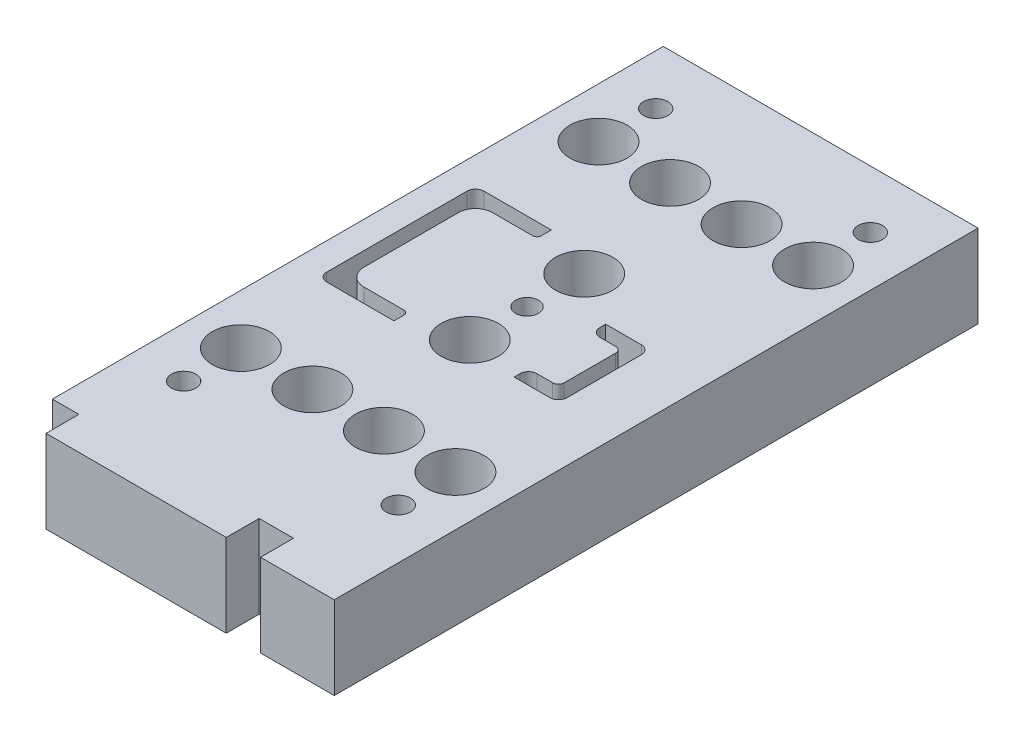
from build123d import *

# Parameters (mm, degrees)
SKETCH1_W           = 110
SKETCH1_H           = 225
BOSS_EXTRUDE1_DEPTH = 29
CUT_EXTRUDE1_REACH  = 130.539
CUT_EXTRUDE2_REACH  = 130.539
SKETCH4_R           = 8.5
CUT_EXTRUDE3_DEPTH  = 5
SKETCH5_R           = 10
CUT_EXTRUDE4_DEPTH  = 20
CUT_EXTRUDE5_REACH  = 130.539
SKETCH6_W           = 12
SKETCH6_H           = 11.5
M10_TAPPED_HOLE1_D  = 8.5
CUT_EXTRUDE6_REACH  = 130.539
SKETCH10_R          = 4


with BuildPart() as part:
    # Sketch1 → Boss-Extrude1 (new body)
    with BuildSketch(Plane(origin=(0, 0, 0), x_dir=(1, 0, 0), z_dir=(0, 1, 0))):
        Rectangle(SKETCH1_W, SKETCH1_H)
    extrude(amount=-BOSS_EXTRUDE1_DEPTH)

    # Sketch2 → Cut-Extrude1 (cut, up to next)
    with BuildSketch(Plane(origin=(0, 0, 0), x_dir=(1, 0, 0), z_dir=(0, 1, 0)), mode=Mode.PRIVATE) as cut_extrude1_sk1:
        with BuildLine():
            Line((-19, 37.36), (-19, 33.86))
            ThreePointArc((-19, 33.86), (-19.439339828, 32.799339828), (-20.5, 32.36))
            Line((-20.5, 32.36), (-34.5, 32.36))
            ThreePointArc((-34.5, 32.36), (-38.742640687, 30.602640687), (-40.5, 26.36))
            Line((-40.5, 26.36), (-40.5, -6.64))
            ThreePointArc((-40.5, -6.64), (-38.742640687, -10.882640687), (-34.5, -12.64))
            Line((-34.5, -12.64), (-20.5, -12.64))
            ThreePointArc((-20.5, -12.64), (-19.439339828, -13.079339828), (-19, -14.14))
            Line((-19, -14.14), (-19, -17.64))
            Line((-19, -17.64), (-42.5, -17.64))
            ThreePointArc((-42.5, -17.64), (-44.621320344, -16.761320344), (-45.5, -14.64))
            Line((-45.5, -14.64), (-45.5, 34.36))
            ThreePointArc((-45.5, 34.36), (-44.621320344, 36.481320344), (-42.5, 37.36))
            Line((-42.5, 37.36), (-19, 37.36))
        make_face()
    cut_extrude1_tool1 = extrude(cut_extrude1_sk1.sketch, amount=-CUT_EXTRUDE1_REACH, mode=Mode.PRIVATE) & part.part
    add(cut_extrude1_tool1.solids().sort_by_distance((-19.610512, 0, -35.61))[0], mode=Mode.SUBTRACT)

    # Sketch3 → Cut-Extrude2 (cut, up to next)
    with BuildSketch(Plane(origin=(0, 0, 0), x_dir=(1, 0, 0), z_dir=(0, 1, 0)), mode=Mode.PRIVATE) as cut_extrude2_sk1:
        with BuildLine():
            Line((19, 18.36), (31.5, 18.36))
            ThreePointArc((31.5, 18.36), (33.621320344, 17.481320344), (34.5, 15.36))
            Line((34.5, 15.36), (34.5, -10.64))
            ThreePointArc((34.5, -10.64), (33.621320344, -12.761320344), (31.5, -13.64))
            Line((31.5, -13.64), (19, -13.64))
            Line((19, -13.64), (19, -11.64))
            ThreePointArc((19, -11.64), (19.878679656, -9.518679656), (22, -8.64))
            Line((22, -8.64), (27.5, -8.64))
            ThreePointArc((27.5, -8.64), (28.914213562, -8.054213562), (29.5, -6.64))
            Line((29.5, -6.64), (29.5, 11.36))
            ThreePointArc((29.5, 11.36), (28.914213562, 12.774213562), (27.5, 13.36))
            Line((27.5, 13.36), (22, 13.36))
            ThreePointArc((22, 13.36), (19.878679656, 14.238679656), (19, 16.36))
            Line((19, 16.36), (19, 18.36))
        make_face()
    cut_extrude2_tool1 = extrude(cut_extrude2_sk1.sketch, amount=-CUT_EXTRUDE2_REACH, mode=Mode.PRIVATE) & part.part
    add(cut_extrude2_tool1.solids().sort_by_distance((25.25, 0, -18.004437))[0], mode=Mode.SUBTRACT)

    # Sketch4 → Cut-Extrude3 (cut)
    with BuildSketch(Plane.XZ.offset(29)):
        with Locations((0, 100)):
            Circle(SKETCH4_R)
        with Locations((0, -100)):
            Circle(SKETCH4_R)
    extrude(amount=-CUT_EXTRUDE3_DEPTH, mode=Mode.SUBTRACT)

    # Sketch5 → Cut-Extrude4 (cut)
    with BuildSketch(Plane(origin=(0, 0, 0), x_dir=(1, 0, 0), z_dir=(0, 1, 0))):
        with Locations((-37.5, 72.36)):
            Circle(SKETCH5_R)
        with Locations((-12.5, 72.36)):
            Circle(SKETCH5_R)
        with Locations((12.5, 72.36)):
            Circle(SKETCH5_R)
        with Locations((37.5, 72.36)):
            Circle(SKETCH5_R)
        with Locations((37.5, -52.64)):
            Circle(SKETCH5_R)
        with Locations((12.5, -52.64)):
            Circle(SKETCH5_R)
        with Locations((-12.5, -52.64)):
            Circle(SKETCH5_R)
        with Locations((-37.5, -52.64)):
            Circle(SKETCH5_R)
        with Locations((0, 29.86)):
            Circle(SKETCH5_R)
        with Locations((0, -10.14)):
            Circle(SKETCH5_R)
    extrude(amount=-CUT_EXTRUDE4_DEPTH, mode=Mode.SUBTRACT)

    # Sketch6 → Cut-Extrude5 (cut, up to next)
    with BuildSketch(Plane(origin=(0, 0, 0), x_dir=(1, 0, 0), z_dir=(0, 1, 0)), mode=Mode.PRIVATE) as cut_extrude5_sk1:
        with Locations((23.25, -106.75)):
            Rectangle(SKETCH6_W, SKETCH6_H)
    cut_extrude5_tool1 = extrude(cut_extrude5_sk1.sketch, amount=-CUT_EXTRUDE5_REACH, mode=Mode.PRIVATE) & part.part
    # Sketch6 → Cut-Extrude5 (cut, up to next)
    with BuildSketch(Plane(origin=(0, 0, 0), x_dir=(1, 0, 0), z_dir=(0, 1, 0)), mode=Mode.PRIVATE) as cut_extrude5_sk2:
        with Locations((-51.75, -106.75)):
            Rectangle(SKETCH6_W, SKETCH6_H)
    cut_extrude5_tool2 = extrude(cut_extrude5_sk2.sketch, amount=-CUT_EXTRUDE5_REACH, mode=Mode.PRIVATE) & part.part
    add(cut_extrude5_tool1.solids().sort_by_distance((23.25, 0, 106.75))[0], mode=Mode.SUBTRACT)
    add(cut_extrude5_tool2.solids().sort_by_distance((-51.75, 0, 106.75))[0], mode=Mode.SUBTRACT)

    # M10 Tapped Hole1 (through all)
    with Locations(Plane(origin=(0, 0, 0), x_dir=(1, 0, 0), z_dir=(0, 1, 0))):
        with Locations((-37.5, -72.64), (37.5, -72.64), (37.5, 92.36), (-37.5, 92.36)):
            Hole(M10_TAPPED_HOLE1_D / 2)

    # Sketch10 → Cut-Extrude6 (cut, up to next)
    with BuildSketch(Plane(origin=(0, 0, 0), x_dir=(1, 0, 0), z_dir=(0, 1, 0)), mode=Mode.PRIVATE) as cut_extrude6_sk1:
        with Locations((0, 9.86)):
            Circle(SKETCH10_R)
    cut_extrude6_tool1 = extrude(cut_extrude6_sk1.sketch, amount=-CUT_EXTRUDE6_REACH, mode=Mode.PRIVATE) & part.part
    add(cut_extrude6_tool1.solids().sort_by_distance((0, 0, -9.86))[0], mode=Mode.SUBTRACT)


solid = part.part
